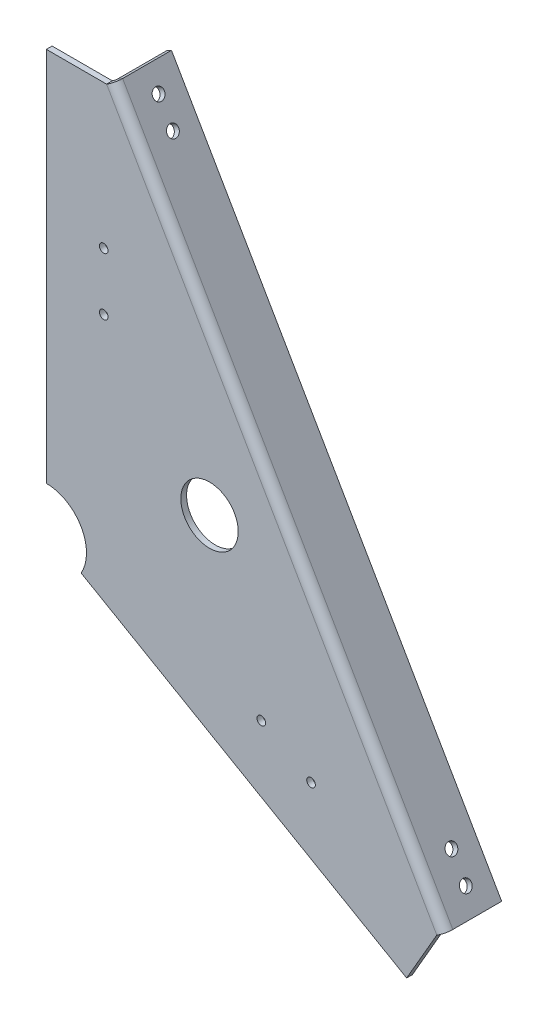
from build123d import *

# Parameters (mm, degrees)
SKETCH_10_R                   = 10
SM_BASE_FLANGE_3_DEPTH        = 2
SM_EDGE_FLANGE_6_DEPTH        = 230
SM_EDGE_FLANGE_6_BEND_DEPTH   = 230
SM_EDGE_FLANGE_6_BEND_2_DEPTH = 230
CUT_EXTRUDE_4_REACH           = 363.137
SKETCH_47_R                   = 2
CUT_EXTRUDE_6_REACH           = 263.424
SKETCH_50_R                   = 2
CUT_EXTRUDE_7_REACH           = 351.772
SKETCH_51_R                   = 2
CUT_EXTRUDE_8_REACH           = 349.61
SKETCH_52_R                   = 14
SKETCH_53_R                   = 1.5
CUT_EXTRUDE_9_DEPTH           = 10
OTHER_START                   = -20
OTHER_2_OUTLINE_R             = 1.5
OTHER_2_DEPTH                 = 20


# Read off the part's stored shape, not the designer's step: Полость2
# Sheet-metal steps are written as plain solids
with BuildPart() as part:
    # Эскиз10 → Базовая кромка3 (new body)
    with BuildSketch(Plane.XY):
        Polygon((0, 0), (-21, 36.373066959), (94, 235.558909829), (136, 235.558909829), (251, 36.373066959), (230, 0), align=None)
        with Locations((171.849364905, 123.465988394)):
            Circle(SKETCH_10_R, mode=Mode.SUBTRACT)
    extrude(amount=-SM_BASE_FLANGE_3_DEPTH)

    # Ребро-кромка6 section (across the edge) → Ребро-кромка6 (add)
    with BuildSketch(Plane(origin=(-21.866025404, 36.873066959, -2), x_dir=(0.8660254037844436, -0.4999999999999914, -3.4914813388431334e-15), z_dir=(0.4999999999999914, 0.8660254037844436, 0))):
        with BuildLine():
            Line((-2, 1), (-2, 18))
            Line((-2, 18), (0, 18))
            Line((0, 18), (0, 1))
            ThreePointArc((0, 1), (0.292893219, 0.292893219), (1, 0))
            Line((1, 0), (1, -2))
            ThreePointArc((1, -2), (-1.121320344, -1.121320344), (-2, 1))
        make_face()
    extrude(amount=SM_EDGE_FLANGE_6_DEPTH)

    # Ребро-кромка6 section 2 (across the edge) → Ребро-кромка6 bend (add)
    with BuildSketch(Plane(origin=(136.866025404, 236.058909829, -2), x_dir=(-0.8660254037844363, -0.5000000000000041, -3.4914813388431334e-15), z_dir=(0.5000000000000041, -0.8660254037844363, 0))):
        with BuildLine():
            Line((-2, 1), (-2, 18))
            Line((-2, 18), (0, 18))
            Line((0, 18), (0, 1))
            ThreePointArc((0, 1), (0.292893219, 0.292893219), (1, 0))
            Line((1, 0), (1, -2))
            ThreePointArc((1, -2), (-1.121320344, -1.121320344), (-2, 1))
        make_face()
    extrude(amount=SM_EDGE_FLANGE_6_BEND_DEPTH)

    # Ребро-кромка6 section 3 (across the edge) → Ребро-кромка6 bend 2 (add)
    with BuildSketch(Plane(origin=(230, -1, -2), x_dir=(0, 1, 0), z_dir=(-1, 0, 0))):
        with BuildLine():
            Line((-2, 1), (-2, 18))
            Line((-2, 18), (0, 18))
            Line((0, 18), (0, 1))
            ThreePointArc((0, 1), (0.292893219, 0.292893219), (1, 0))
            Line((1, 0), (1, -2))
            ThreePointArc((1, -2), (-1.121320344, -1.121320344), (-2, 1))
        make_face()
    extrude(amount=SM_EDGE_FLANGE_6_BEND_2_DEPTH)

    # Эскиз47 → Вырез-Вытянуть4 (cut, up to next)
    with BuildSketch(Plane(origin=(-34.098076211, 19.686533479, 0), x_dir=(0, 0, 1), z_dir=(-0.866025403784443, 0.4999999999999925, 3.788649256556814e-15)), mode=Mode.PRIVATE) as cut_extrude_4_sk1:
        with Locations(Location((-11.5, 29, 0), (0, 0, 270))):
            Circle(SKETCH_47_R)
    cut_extrude_4_tool1 = extrude(cut_extrude_4_sk1.sketch, amount=-CUT_EXTRUDE_4_REACH, mode=Mode.PRIVATE) & part.part
    # Эскиз47 → Вырез-Вытянуть4 (cut, up to next)
    with BuildSketch(Plane(origin=(-34.098076211, 19.686533479, 0), x_dir=(0, 0, 1), z_dir=(-0.866025403784443, 0.4999999999999925, 3.788649256556814e-15)), mode=Mode.PRIVATE) as cut_extrude_4_sk2:
        with Locations(Location((-11.5, 39, 0), (0, 0, 270))):
            Circle(SKETCH_47_R)
    cut_extrude_4_tool2 = extrude(cut_extrude_4_sk2.sketch, amount=-CUT_EXTRUDE_4_REACH, mode=Mode.PRIVATE) & part.part
    # Эскиз47 → Вырез-Вытянуть4 (cut, up to next)
    with BuildSketch(Plane(origin=(-34.098076211, 19.686533479, 0), x_dir=(0, 0, 1), z_dir=(-0.866025403784443, 0.4999999999999925, 3.788649256556814e-15)), mode=Mode.PRIVATE) as cut_extrude_4_sk3:
        with Locations(Location((-11.5, 233, 0), (0, 0, 270))):
            Circle(SKETCH_47_R)
    cut_extrude_4_tool3 = extrude(cut_extrude_4_sk3.sketch, amount=-CUT_EXTRUDE_4_REACH, mode=Mode.PRIVATE) & part.part
    # Эскиз47 → Вырез-Вытянуть4 (cut, up to next)
    with BuildSketch(Plane(origin=(-34.098076211, 19.686533479, 0), x_dir=(0, 0, 1), z_dir=(-0.866025403784443, 0.4999999999999925, 3.788649256556814e-15)), mode=Mode.PRIVATE) as cut_extrude_4_sk4:
        with Locations(Location((-11.5, 243, 0), (0, 0, 270))):
            Circle(SKETCH_47_R)
    cut_extrude_4_tool4 = extrude(cut_extrude_4_sk4.sketch, amount=-CUT_EXTRUDE_4_REACH, mode=Mode.PRIVATE) & part.part
    add(cut_extrude_4_tool1.solids().sort_by_distance((-19.598076, 44.80127, -11.5))[0], mode=Mode.SUBTRACT)
    add(cut_extrude_4_tool2.solids().sort_by_distance((-14.598076, 53.461524, -11.5))[0], mode=Mode.SUBTRACT)
    add(cut_extrude_4_tool3.solids().sort_by_distance((82.401924, 221.470453, -11.5))[0], mode=Mode.SUBTRACT)
    add(cut_extrude_4_tool4.solids().sort_by_distance((87.401924, 230.130707, -11.5))[0], mode=Mode.SUBTRACT)

    # Эскиз50 → Вырез-Вытянуть6 (cut, up to next)
    with BuildSketch(Plane(origin=(206.598076211, 119.279454915, 0), x_dir=(0, 0, -1), z_dir=(0.866025403784436, 0.5000000000000047, 3.0623287353932815e-15)), mode=Mode.PRIVATE) as cut_extrude_6_sk1:
        with Locations(Location((11.5, -86, 0), (0, 0, 90))):
            Circle(SKETCH_50_R)
    cut_extrude_6_tool1 = extrude(cut_extrude_6_sk1.sketch, amount=-CUT_EXTRUDE_6_REACH, mode=Mode.PRIVATE) & part.part
    # Эскиз50 → Вырез-Вытянуть6 (cut, up to next)
    with BuildSketch(Plane(origin=(206.598076211, 119.279454915, 0), x_dir=(0, 0, -1), z_dir=(0.866025403784436, 0.5000000000000047, 3.0623287353932815e-15)), mode=Mode.PRIVATE) as cut_extrude_6_sk2:
        with Locations(Location((11.5, -76, 0), (0, 0, 90))):
            Circle(SKETCH_50_R)
    cut_extrude_6_tool2 = extrude(cut_extrude_6_sk2.sketch, amount=-CUT_EXTRUDE_6_REACH, mode=Mode.PRIVATE) & part.part
    # Эскиз50 → Вырез-Вытянуть6 (cut, up to next)
    with BuildSketch(Plane(origin=(206.598076211, 119.279454915, 0), x_dir=(0, 0, -1), z_dir=(0.866025403784436, 0.5000000000000047, 3.0623287353932815e-15)), mode=Mode.PRIVATE) as cut_extrude_6_sk3:
        with Locations(Location((11.5, 118, 0), (0, 0, 90))):
            Circle(SKETCH_50_R)
    cut_extrude_6_tool3 = extrude(cut_extrude_6_sk3.sketch, amount=-CUT_EXTRUDE_6_REACH, mode=Mode.PRIVATE) & part.part
    # Эскиз50 → Вырез-Вытянуть6 (cut, up to next)
    with BuildSketch(Plane(origin=(206.598076211, 119.279454915, 0), x_dir=(0, 0, -1), z_dir=(0.866025403784436, 0.5000000000000047, 3.0623287353932815e-15)), mode=Mode.PRIVATE) as cut_extrude_6_sk4:
        with Locations(Location((11.5, 128, 0), (0, 0, 90))):
            Circle(SKETCH_50_R)
    cut_extrude_6_tool4 = extrude(cut_extrude_6_sk4.sketch, amount=-CUT_EXTRUDE_6_REACH, mode=Mode.PRIVATE) & part.part
    add(cut_extrude_6_tool1.solids().sort_by_distance((249.598076, 44.80127, -11.5))[0], mode=Mode.SUBTRACT)
    add(cut_extrude_6_tool2.solids().sort_by_distance((244.598076, 53.461524, -11.5))[0], mode=Mode.SUBTRACT)
    add(cut_extrude_6_tool3.solids().sort_by_distance((147.598076, 221.470453, -11.5))[0], mode=Mode.SUBTRACT)
    add(cut_extrude_6_tool4.solids().sort_by_distance((142.598076, 230.130707, -11.5))[0], mode=Mode.SUBTRACT)

    # Эскиз51 → Вырез-Вытянуть7 (cut, up to next)
    with BuildSketch(Plane.XZ.offset(3), mode=Mode.PRIVATE) as cut_extrude_7_sk1:
        with Locations(Location((222, -11.5, 0), (0, 0, 270))):
            Circle(SKETCH_51_R)
    cut_extrude_7_tool1 = extrude(cut_extrude_7_sk1.sketch, amount=-CUT_EXTRUDE_7_REACH, mode=Mode.PRIVATE) & part.part
    # Эскиз51 → Вырез-Вытянуть7 (cut, up to next)
    with BuildSketch(Plane.XZ.offset(3), mode=Mode.PRIVATE) as cut_extrude_7_sk2:
        with Locations(Location((212, -11.5, 0), (0, 0, 270))):
            Circle(SKETCH_51_R)
    cut_extrude_7_tool2 = extrude(cut_extrude_7_sk2.sketch, amount=-CUT_EXTRUDE_7_REACH, mode=Mode.PRIVATE) & part.part
    # Эскиз51 → Вырез-Вытянуть7 (cut, up to next)
    with BuildSketch(Plane.XZ.offset(3), mode=Mode.PRIVATE) as cut_extrude_7_sk3:
        with Locations(Location((18, -11.5, 0), (0, 0, 270))):
            Circle(SKETCH_51_R)
    cut_extrude_7_tool3 = extrude(cut_extrude_7_sk3.sketch, amount=-CUT_EXTRUDE_7_REACH, mode=Mode.PRIVATE) & part.part
    # Эскиз51 → Вырез-Вытянуть7 (cut, up to next)
    with BuildSketch(Plane.XZ.offset(3), mode=Mode.PRIVATE) as cut_extrude_7_sk4:
        with Locations(Location((8, -11.5, 0), (0, 0, 270))):
            Circle(SKETCH_51_R)
    cut_extrude_7_tool4 = extrude(cut_extrude_7_sk4.sketch, amount=-CUT_EXTRUDE_7_REACH, mode=Mode.PRIVATE) & part.part
    add(cut_extrude_7_tool1.solids().sort_by_distance((222, -3, -11.5))[0], mode=Mode.SUBTRACT)
    add(cut_extrude_7_tool2.solids().sort_by_distance((212, -3, -11.5))[0], mode=Mode.SUBTRACT)
    add(cut_extrude_7_tool3.solids().sort_by_distance((18, -3, -11.5))[0], mode=Mode.SUBTRACT)
    add(cut_extrude_7_tool4.solids().sort_by_distance((8, -3, -11.5))[0], mode=Mode.SUBTRACT)

    # Эскиз52 → Вырез-Вытянуть8 (cut, up to next)
    with BuildSketch(Plane(origin=(0, 0, -2), x_dir=(-1, 0, 0), z_dir=(0, 0, -1)), mode=Mode.PRIVATE) as cut_extrude_8_sk1:
        with Locations((-115, 90.643992263)):
            Circle(SKETCH_52_R)
    cut_extrude_8_tool1 = extrude(cut_extrude_8_sk1.sketch, amount=-CUT_EXTRUDE_8_REACH, mode=Mode.PRIVATE) & part.part
    add(cut_extrude_8_tool1.solids().sort_by_distance((115, 90.643992, -2))[0], mode=Mode.SUBTRACT)

    # Эскиз53 → Вырез-Вытянуть9 (cut)
    with BuildSketch(Plane(origin=(0, 0, -2), x_dir=(-1, 0, 0), z_dir=(0, 0, -1))):
        with Locations((-40.121778265, 70.507041555)):
            Circle(SKETCH_53_R)
        with Locations((-22.801270189, 60.507041555)):
            Circle(SKETCH_53_R)
        with Locations((-60.121778265, 35.866025404)):
            Circle(SKETCH_53_R)
        with Locations((-42.801270189, 25.866025404)):
            Circle(SKETCH_53_R)
        with Locations((-95, 185.558909829)):
            Circle(SKETCH_53_R)
        with Locations((-95, 165.558909829)):
            Circle(SKETCH_53_R)
        with Locations((-135, 185.558909829)):
            Circle(SKETCH_53_R)
        with Locations((-135, 165.558909829)):
            Circle(SKETCH_53_R)
        with Locations((-207.198729811, 60.507041555)):
            Circle(SKETCH_53_R)
        with Locations((-189.878221735, 70.507041555)):
            Circle(SKETCH_53_R)
        with Locations((-187.198729811, 25.866025404)):
            Circle(SKETCH_53_R)
        with Locations((-169.878221735, 35.866025404)):
            Circle(SKETCH_53_R)
    extrude(amount=-CUT_EXTRUDE_9_DEPTH, mode=Mode.SUBTRACT)

    # Полость2 outline → Полость2 (cut)
    with BuildSketch(Plane.XY.offset(OTHER_START)):
        with BuildLine():
            Line((115.008517475, 104.643989672), (115.008517475, 235.558909829))
            Line((115.008517475, 235.558909829), (94, 235.558909829))
            Line((94, 235.558909829), (91.401923789, 237.058909829))
            Line((91.401923789, 237.058909829), (-23.598076211, 37.873066959))
            Line((-23.598076211, 37.873066959), (-21, 36.373066959))
            Line((-21, 36.373066959), (0, 0))
            Line((0, 0), (0, -3))
            Line((0, -3), (230, -3))
            Line((230, -3), (230, 0))
            Line((230, 0), (240.504258738, 18.193909829))
            Line((240.504258738, 18.193909829), (127.128612147, 83.651369908))
            ThreePointArc((127.128612147, 83.651369908), (102.875644347, 83.643992263), (115.008517475, 104.643989672))
        make_face()
        with Locations((42.801270189, 25.866025404)):
            Circle(OTHER_2_OUTLINE_R, mode=Mode.SUBTRACT)
        with Locations((60.121778265, 35.866025404)):
            Circle(OTHER_2_OUTLINE_R, mode=Mode.SUBTRACT)
        with Locations((22.801270189, 60.507041555)):
            Circle(OTHER_2_OUTLINE_R, mode=Mode.SUBTRACT)
        with Locations((40.121778265, 70.507041555)):
            Circle(OTHER_2_OUTLINE_R, mode=Mode.SUBTRACT)
        with Locations((169.878221735, 35.866025404)):
            Circle(OTHER_2_OUTLINE_R, mode=Mode.SUBTRACT)
        with Locations((187.198729811, 25.866025404)):
            Circle(OTHER_2_OUTLINE_R, mode=Mode.SUBTRACT)
        with Locations((95, 165.558909829)):
            Circle(OTHER_2_OUTLINE_R, mode=Mode.SUBTRACT)
        with Locations((95, 185.558909829)):
            Circle(OTHER_2_OUTLINE_R, mode=Mode.SUBTRACT)
    extrude(amount=OTHER_2_DEPTH, mode=Mode.SUBTRACT)


solid = part.part
